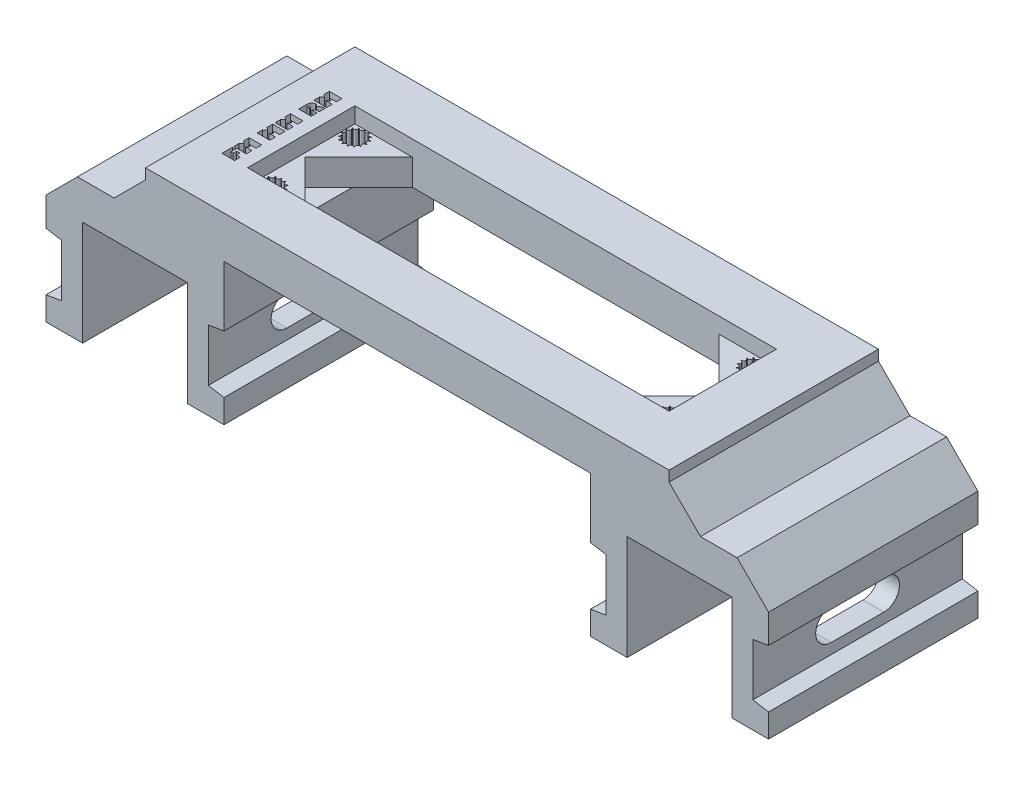
from build123d import *

# Parameters (mm, degrees)
SKETCH1_W                                = 80
SKETCH1_H                                = 20
BOSS_EXTRUDE1_DEPTH                      = 8
CUT_EXTRUDE1_DEPTH                       = 8
SKETCH3_W                                = 100
SKETCH3_H                                = 40
SKETCH3_W_2                              = 80
SKETCH3_H_2                              = 20
BOSS_EXTRUDE2_DEPTH                      = 8
CUT_EXTRUDE2_DEPTH                       = 12
MIRROR1_AT_THE_SECOND_PLANE_COPY_1_DEPTH = 12
BOSS_EXTRUDE3_START                      = -0.0001
SKETCH4_W                                = 34
SKETCH4_H                                = 40
BOSS_EXTRUDE3_DEPTH                      = 27.0001
SKETCH5_W                                = 20
SKETCH5_H                                = 20.0001
CUT_EXTRUDE3_DEPTH                       = 51
CUT_EXTRUDE4_DEPTH                       = 51
MIRROR3_COPY_1_DEPTH                     = 51
FILLET1_SIZE                             = 6
CUT_EXTRUDE5_DEPTH                       = 160
SKETCH8_W                                = 80.5
SKETCH8_H                                = 20.5
CUT_EXTRUDE6_DEPTH                       = 3
CUT_EXTRUDE8_START                       = -5
CUT_EXTRUDE8_DEPTH                       = 5
BOSS_EXTRUDE4_DEPTH                      = 5
MIRROR7_COPY_1_DEPTH                     = 5
CUT_EXTRUDE9_DEPTH                       = 2


with BuildPart() as part:
    # Sketch1 → Boss-Extrude1 (new body)
    with BuildSketch(Plane(origin=(0, 0, 0), x_dir=(1, 0, 0), z_dir=(0, 1, 0))):
        with Locations((40, 10)):
            Rectangle(SKETCH1_W, SKETCH1_H)
    extrude(amount=BOSS_EXTRUDE1_DEPTH)

    # Sketch2 → Cut-Extrude1 (cut)
    with BuildSketch(Plane(origin=(0, 8, 0), x_dir=(1, 0, 0), z_dir=(0, 1, 0))):
        with BuildLine():
            ThreePointArc((0, 5.464101615), (4.828427125, 4.828427125), (5.464101615, 0))
            Line((5.464101615, 0), (74.535898385, 0))
            ThreePointArc((74.535898385, 0), (75.171572875, 4.828427125), (80, 5.464101615))
            Line((80, 5.464101615), (80, 14.535898385))
            ThreePointArc((80, 14.535898385), (75.171572875, 15.171572875), (74.535898385, 20))
            Line((74.535898385, 20), (5.464101615, 20))
            ThreePointArc((5.464101615, 20), (4.828427125, 15.171572875), (0, 14.535898385))
            Line((0, 14.535898385), (0, 5.464101615))
        make_face()
    extrude(amount=-CUT_EXTRUDE1_DEPTH, mode=Mode.SUBTRACT)


with BuildPart() as cut_extrude1_piece_1:
    # of the separate pieces the step leaves, piece 1, a body of its own (cut_extrude1_pieces)
    add(part.part.solids().sort_by_distance((74.535898385, 0, 0))[0])



with BuildPart() as cut_extrude1_piece_2:
    # of the separate pieces the step leaves, piece 2, a body of its own (cut_extrude1_pieces)
    add(part.part.solids().sort_by_distance((80, 0, -14.535898385))[0])


with BuildPart() as cut_extrude1_piece_3:
    # of the separate pieces the step leaves, piece 3, a body of its own (cut_extrude1_pieces)
    add(part.part.solids().sort_by_distance((0, 0, 0))[0])


with BuildPart() as cut_extrude1_piece_4:
    # of the separate pieces the step leaves, piece 4, a body of its own (cut_extrude1_pieces)
    add(part.part.solids().sort_by_distance((0, 0, -20))[0])


with BuildPart() as cut_extrude1_piece_1_1:
    add(cut_extrude1_piece_1.part)

    add(cut_extrude1_piece_2.part)  # Boss-Extrude2 merges Cut-Extrude1 piece 2

    add(cut_extrude1_piece_3.part)  # Boss-Extrude2 merges Cut-Extrude1 piece 3

    add(cut_extrude1_piece_4.part)  # Boss-Extrude2 merges Cut-Extrude1 piece 4
    # Sketch3 → Boss-Extrude2 (add)
    with BuildSketch(Plane(origin=(0, 8, 0), x_dir=(1, 0, 0), z_dir=(0, 1, 0))):
        with Locations((40, 10)):
            Rectangle(SKETCH3_W, SKETCH3_H)
        with Locations((40, 10)):
            Rectangle(SKETCH3_W_2, SKETCH3_H_2, mode=Mode.SUBTRACT)
    extrude(amount=-BOSS_EXTRUDE2_DEPTH)

    # Sketch2<3> → Cut-Extrude2 (cut)
    with BuildSketch(Plane(origin=(0, 8, 0), x_dir=(1, 0, 0), z_dir=(0, 1, 0))):
        with BuildLine():
            Line((2.55692021, 0), (2.72832175, 0))
            ThreePointArc((2.72832175, 0), (2.980061227, 0.424260159), (3.452261136, 0.281443165))
            ThreePointArc((3.452261136, 0.281443165), (3.505543864, 0.327924143), (3.557339776, 0.376056398))
            ThreePointArc((3.557339776, 0.376056398), (3.49668144, 0.912597283), (4.025706602, 1.020708029))
            ThreePointArc((4.025706602, 1.020708029), (4.05547728, 1.084842553), (4.083218047, 1.149880851))
            ThreePointArc((4.083218047, 1.149880851), (3.809573061, 1.615363372), (4.248888993, 1.929301372))
            ThreePointArc((4.248888993, 1.929301372), (4.249722231, 1.964646321), (4.25, 2))
            ThreePointArc((4.25, 2), (4.249722231, 2.035353679), (4.248888993, 2.070698628))
            ThreePointArc((4.248888993, 2.070698628), (3.809573061, 2.384636628), (4.083218047, 2.850119149))
            ThreePointArc((4.083218047, 2.850119149), (4.05547728, 2.915157447), (4.025706602, 2.979291971))
            ThreePointArc((4.025706602, 2.979291971), (3.49668144, 3.087402717), (3.557339776, 3.623943602))
            ThreePointArc((3.557339776, 3.623943602), (3.505543864, 3.672075857), (3.452261136, 3.718556835))
            ThreePointArc((3.452261136, 3.718556835), (2.925, 3.602146997), (2.762183309, 4.116973454))
            ThreePointArc((2.762183309, 4.116973454), (2.695288237, 4.139877162), (2.627706526, 4.160667609))
            ThreePointArc((2.627706526, 4.160667609), (2.193377657, 3.839865506), (1.835238423, 4.243959363))
            ThreePointArc((1.835238423, 4.243959363), (1.764810958, 4.237674265), (1.694615755, 4.229179325))
            ThreePointArc((1.694615755, 4.229179325), (1.702179747, 4.184812687), (1.704711763, 4.139877162))
            ThreePointArc((1.704711763, 4.139877162), (1.3847999, 3.747976804), (0.936782312, 3.982944313))
            ThreePointArc((0.936782312, 3.982944313), (0.875, 3.948557159), (0.814328695, 3.912245684))
            ThreePointArc((0.814328695, 3.912245684), (0.87389587, 3.798667674), (0.894456136, 3.672075857))
            ThreePointArc((0.894456136, 3.672075857), (0.654274821, 3.305390723), (0.222166197, 3.379060176))
            ThreePointArc((0.222166197, 3.379060176), (0.179711763, 3.322516818), (0.139054975, 3.264667392))
            ThreePointArc((0.139054975, 3.264667392), (0.289350867, 3.117872886), (0.34452272, 2.915157447))
            ThreePointArc((0.34452272, 2.915157447), (0.246342958, 2.652660696), (0, 2.519023289))
            Line((0, 2.519023289), (0, 2.3122499))
            ThreePointArc((0, 2.3122499), (0.110555128, 2.173205081), (0.15, 2))
            ThreePointArc((0.15, 2), (0.110555128, 1.826794919), (0, 1.6877501))
            Line((0, 1.6877501), (0, 1.480976711))
            ThreePointArc((0, 1.480976711), (0.246342958, 1.347339304), (0.34452272, 1.084842553))
            ThreePointArc((0.34452272, 1.084842553), (0.289350867, 0.882127114), (0.139054975, 0.735332608))
            ThreePointArc((0.139054975, 0.735332608), (0.179711763, 0.677483182), (0.222166197, 0.620939824))
            ThreePointArc((0.222166197, 0.620939824), (0.654274821, 0.694609277), (0.894456136, 0.327924143))
            ThreePointArc((0.894456136, 0.327924143), (0.87389587, 0.201332326), (0.814328695, 0.087754316))
            ThreePointArc((0.814328695, 0.087754316), (0.875, 0.051442841), (0.936782312, 0.017055687))
            ThreePointArc((0.936782312, 0.017055687), (1.313895423, 0.2600174), (1.679457516, 0))
            Line((1.679457516, 0), (1.913457875, 0))
            ThreePointArc((1.913457875, 0), (2.235189042, 0.162325735), (2.55692021, 0))
        make_face()
        with BuildLine():
            ThreePointArc((0, 1.6877501), (-0.100863587, 1.628841907), (-0.214444444, 1.601583381))
            ThreePointArc((-0.214444444, 1.601583381), (-0.200832102, 1.532198696), (-0.185046302, 1.463275993))
            ThreePointArc((-0.185046302, 1.463275993), (-0.093565669, 1.483025017), (0, 1.480976711))
            Line((0, 1.480976711), (0, 1.6877501))
        make_face()
        with BuildLine():
            ThreePointArc((0, 2.519023289), (-0.093565669, 2.516974983), (-0.185046302, 2.536724007))
            ThreePointArc((-0.185046302, 2.536724007), (-0.200832102, 2.467801304), (-0.214444444, 2.398416619))
            ThreePointArc((-0.214444444, 2.398416619), (-0.100863587, 2.371158093), (0, 2.3122499))
            Line((0, 2.3122499), (0, 2.519023289))
        make_face()
        with BuildLine():
            ThreePointArc((1.694615755, -0.229179325), (1.764810958, -0.237674265), (1.835238423, -0.243959363))
            ThreePointArc((1.835238423, -0.243959363), (1.85428854, -0.115548071), (1.913457875, 0))
            Line((1.913457875, 0), (1.679457516, 0))
            ThreePointArc((1.679457516, 0), (1.698347572, -0.068807834), (1.704711763, -0.139877162))
            ThreePointArc((1.704711763, -0.139877162), (1.702179747, -0.184812687), (1.694615755, -0.229179325))
        make_face()
        with BuildLine():
            ThreePointArc((2.627706526, -0.160667609), (2.695288237, -0.139877162), (2.762183309, -0.116973454))
            ThreePointArc((2.762183309, -0.116973454), (2.740775016, -0.059782881), (2.72832175, 0))
            Line((2.72832175, 0), (2.55692021, 0))
            ThreePointArc((2.55692021, 0), (2.601237269, -0.076402147), (2.627706526, -0.160667609))
        make_face()
    cut_extrude2 = extrude(amount=-CUT_EXTRUDE2_DEPTH, mode=Mode.SUBTRACT)

    # Mirror1: Cut-Extrude2 across plane
    add(cut_extrude2.mirror(Plane.XY.offset(-10)), mode=Mode.SUBTRACT)

    # Mirror1 at the second plane: Cut-Extrude2 across plane
    add(cut_extrude2.mirror(Plane.ZY.offset(-40)), mode=Mode.SUBTRACT)

    # Mirror1 at the second plane copy 1 sketc → Mirror1 at the second plane copy 1 (cut)
    with BuildSketch(Plane(origin=(80, 8, -20), x_dir=(-1, 0, 0), z_dir=(0, 1, 0))):
        with BuildLine():
            Line((2.55692021, 0), (2.72832175, 0))
            ThreePointArc((2.72832175, 0), (2.980061227, 0.424260159), (3.452261136, 0.281443165))
            ThreePointArc((3.452261136, 0.281443165), (3.505543864, 0.327924143), (3.557339776, 0.376056398))
            ThreePointArc((3.557339776, 0.376056398), (3.49668144, 0.912597283), (4.025706602, 1.020708029))
            ThreePointArc((4.025706602, 1.020708029), (4.05547728, 1.084842553), (4.083218047, 1.149880851))
            ThreePointArc((4.083218047, 1.149880851), (3.809573061, 1.615363372), (4.248888993, 1.929301372))
            ThreePointArc((4.248888993, 1.929301372), (4.249722231, 1.964646321), (4.25, 2))
            ThreePointArc((4.25, 2), (4.249722231, 2.035353679), (4.248888993, 2.070698628))
            ThreePointArc((4.248888993, 2.070698628), (3.809573061, 2.384636628), (4.083218047, 2.850119149))
            ThreePointArc((4.083218047, 2.850119149), (4.05547728, 2.915157447), (4.025706602, 2.979291971))
            ThreePointArc((4.025706602, 2.979291971), (3.49668144, 3.087402717), (3.557339776, 3.623943602))
            ThreePointArc((3.557339776, 3.623943602), (3.505543864, 3.672075857), (3.452261136, 3.718556835))
            ThreePointArc((3.452261136, 3.718556835), (2.925, 3.602146997), (2.762183309, 4.116973454))
            ThreePointArc((2.762183309, 4.116973454), (2.695288237, 4.139877162), (2.627706526, 4.160667609))
            ThreePointArc((2.627706526, 4.160667609), (2.193377657, 3.839865506), (1.835238423, 4.243959363))
            ThreePointArc((1.835238423, 4.243959363), (1.764810958, 4.237674265), (1.694615755, 4.229179325))
            ThreePointArc((1.694615755, 4.229179325), (1.702179747, 4.184812687), (1.704711763, 4.139877162))
            ThreePointArc((1.704711763, 4.139877162), (1.3847999, 3.747976804), (0.936782312, 3.982944313))
            ThreePointArc((0.936782312, 3.982944313), (0.875, 3.948557159), (0.814328695, 3.912245684))
            ThreePointArc((0.814328695, 3.912245684), (0.87389587, 3.798667674), (0.894456136, 3.672075857))
            ThreePointArc((0.894456136, 3.672075857), (0.654274821, 3.305390723), (0.222166197, 3.379060176))
            ThreePointArc((0.222166197, 3.379060176), (0.179711763, 3.322516818), (0.139054975, 3.264667392))
            ThreePointArc((0.139054975, 3.264667392), (0.289350867, 3.117872886), (0.34452272, 2.915157447))
            ThreePointArc((0.34452272, 2.915157447), (0.246342958, 2.652660696), (0, 2.519023289))
            Line((0, 2.519023289), (0, 2.3122499))
            ThreePointArc((0, 2.3122499), (0.110555128, 2.173205081), (0.15, 2))
            ThreePointArc((0.15, 2), (0.110555128, 1.826794919), (0, 1.6877501))
            Line((0, 1.6877501), (0, 1.480976711))
            ThreePointArc((0, 1.480976711), (0.246342958, 1.347339304), (0.34452272, 1.084842553))
            ThreePointArc((0.34452272, 1.084842553), (0.289350867, 0.882127114), (0.139054975, 0.735332608))
            ThreePointArc((0.139054975, 0.735332608), (0.179711763, 0.677483182), (0.222166197, 0.620939824))
            ThreePointArc((0.222166197, 0.620939824), (0.654274821, 0.694609277), (0.894456136, 0.327924143))
            ThreePointArc((0.894456136, 0.327924143), (0.87389587, 0.201332326), (0.814328695, 0.087754316))
            ThreePointArc((0.814328695, 0.087754316), (0.875, 0.051442841), (0.936782312, 0.017055687))
            ThreePointArc((0.936782312, 0.017055687), (1.313895423, 0.2600174), (1.679457516, 0))
            Line((1.679457516, 0), (1.913457875, 0))
            ThreePointArc((1.913457875, 0), (2.235189042, 0.162325735), (2.55692021, 0))
        make_face()
        with BuildLine():
            ThreePointArc((0, 1.6877501), (-0.100863587, 1.628841907), (-0.214444444, 1.601583381))
            ThreePointArc((-0.214444444, 1.601583381), (-0.200832102, 1.532198696), (-0.185046302, 1.463275993))
            ThreePointArc((-0.185046302, 1.463275993), (-0.093565669, 1.483025017), (0, 1.480976711))
            Line((0, 1.480976711), (0, 1.6877501))
        make_face()
        with BuildLine():
            ThreePointArc((0, 2.519023289), (-0.093565669, 2.516974983), (-0.185046302, 2.536724007))
            ThreePointArc((-0.185046302, 2.536724007), (-0.200832102, 2.467801304), (-0.214444444, 2.398416619))
            ThreePointArc((-0.214444444, 2.398416619), (-0.100863587, 2.371158093), (0, 2.3122499))
            Line((0, 2.3122499), (0, 2.519023289))
        make_face()
        with BuildLine():
            ThreePointArc((1.694615755, -0.229179325), (1.764810958, -0.237674265), (1.835238423, -0.243959363))
            ThreePointArc((1.835238423, -0.243959363), (1.85428854, -0.115548071), (1.913457875, 0))
            Line((1.913457875, 0), (1.679457516, 0))
            ThreePointArc((1.679457516, 0), (1.698347572, -0.068807834), (1.704711763, -0.139877162))
            ThreePointArc((1.704711763, -0.139877162), (1.702179747, -0.184812687), (1.694615755, -0.229179325))
        make_face()
        with BuildLine():
            ThreePointArc((2.627706526, -0.160667609), (2.695288237, -0.139877162), (2.762183309, -0.116973454))
            ThreePointArc((2.762183309, -0.116973454), (2.740775016, -0.059782881), (2.72832175, 0))
            Line((2.72832175, 0), (2.55692021, 0))
            ThreePointArc((2.55692021, 0), (2.601237269, -0.076402147), (2.627706526, -0.160667609))
        make_face()
    extrude(amount=-MIRROR1_AT_THE_SECOND_PLANE_COPY_1_DEPTH, mode=Mode.SUBTRACT)

    # Sketch4 → Boss-Extrude3 (add)
    with BuildSketch(Plane.XZ.offset(BOSS_EXTRUDE3_START)):
        with Locations((-12, -10)):
            Rectangle(SKETCH4_W, SKETCH4_H)
    boss_extrude3 = extrude(amount=BOSS_EXTRUDE3_DEPTH)

    # Sketch5 → Cut-Extrude3 (cut)
    with BuildSketch(Plane(origin=(0, 0, -30), x_dir=(-1, 0, 0), z_dir=(0, 0, -1))):
        with Locations((12, -16.99995)):
            Rectangle(SKETCH5_W, SKETCH5_H)
    cut_extrude3 = extrude(amount=-CUT_EXTRUDE3_DEPTH, mode=Mode.SUBTRACT)

    # Sketch6 → Cut-Extrude4 (cut)
    with BuildSketch(Plane(origin=(0, 0, -30), x_dir=(-1, 0, 0), z_dir=(0, 0, -1))):
        Polygon((29, -11.4999), (29, -22.5), (26, -21.99995), (26, -11.99995), align=None)
    cut_extrude4 = extrude(amount=-CUT_EXTRUDE4_DEPTH, mode=Mode.SUBTRACT)

    # Mirror2: Cut-Extrude4 across plane
    add(cut_extrude4.mirror(Plane(origin=(-12, 0, 0), x_dir=(0, 0, 1), z_dir=(1, 0, 0))), mode=Mode.SUBTRACT)

    # Mirror3: Boss-Extrude3, Cut-Extrude3, Cut-Extrude4 across plane
    add(boss_extrude3.mirror(Plane.ZY.offset(-40)))
    add(cut_extrude3.mirror(Plane.ZY.offset(-40)), mode=Mode.SUBTRACT)
    add(cut_extrude4.mirror(Plane.ZY.offset(-40)), mode=Mode.SUBTRACT)

    # Mirror3 copy 1 sketch → Mirror3 copy 1 (cut)
    with BuildSketch(Plane(origin=(104, 0, -30), x_dir=(-1, 0, 0), z_dir=(0, 0, -1))):
        Polygon((29, -11.4999), (29, -22.5), (26, -21.99995), (26, -11.99995), align=None)
    extrude(amount=-MIRROR3_COPY_1_DEPTH, mode=Mode.SUBTRACT)

    # Fillet1
    fillet1_edges = [cut_extrude1_piece_1_1.edges().sort_by_distance(p)[0] for p in [
        (-10, 0.0001, -10),
        (-29, 0.0001, -10),
        (90, 0.0001, -10),
        (109, 0.0001, -10),
    ]]
    chamfer(fillet1_edges, length=FILLET1_SIZE)

    # Sketch7 → Cut-Extrude5 (cut)
    with BuildSketch(Plane.ZY.offset(26)):
        with BuildLine():
            Line((-5, -19.99995), (-15, -19.99995))
            ThreePointArc((-15, -19.99995), (-18, -16.99995), (-15, -13.99995))
            Line((-15, -13.99995), (-5, -13.99995))
            ThreePointArc((-5, -13.99995), (-2, -16.99995), (-5, -19.99995))
        make_face()
    extrude(amount=-CUT_EXTRUDE5_DEPTH, mode=Mode.SUBTRACT)

    # Sketch8 → Cut-Extrude6 (cut)
    with BuildSketch(Plane(origin=(0, 8, 0), x_dir=(1, 0, 0), z_dir=(0, 1, 0))):
        with Locations((40, 10)):
            Rectangle(SKETCH8_W, SKETCH8_H)
    extrude(amount=-CUT_EXTRUDE6_DEPTH, mode=Mode.SUBTRACT)

    # Sketch10 → Cut-Extrude8 (cut)
    with BuildSketch(Plane(origin=(0, 5, 0), x_dir=(1, 0, 0), z_dir=(0, 1, 0)).offset(CUT_EXTRUDE8_START)):
        with BuildLine():
            ThreePointArc((80, 5.464101615), (80.126447832, 5.387952128), (80.25, 5.307189139))
            Line((80.25, 5.307189139), (80.25, 14.692810861))
            ThreePointArc((80.25, 14.692810861), (80.126447832, 14.612047872), (80, 14.535898385))
            Line((80, 14.535898385), (80, 5.464101615))
        make_face()
        with BuildLine():
            Line((5.307189139, -0.25), (74.692810861, -0.25))
            ThreePointArc((74.692810861, -0.25), (74.612047872, -0.126447832), (74.535898385, 0))
            Line((74.535898385, 0), (5.464101615, 0))
            ThreePointArc((5.464101615, 0), (5.387952128, -0.126447832), (5.307189139, -0.25))
        make_face()
        with BuildLine():
            Line((-0.25, 14.692810861), (-0.25, 5.307189139))
            ThreePointArc((-0.25, 5.307189139), (-0.126447832, 5.387952128), (0, 5.464101615))
            Line((0, 5.464101615), (0, 14.535898385))
            ThreePointArc((0, 14.535898385), (-0.126447832, 14.612047872), (-0.25, 14.692810861))
        make_face()
        with BuildLine():
            ThreePointArc((74.535898385, 20), (74.612047872, 20.126447832), (74.692810861, 20.25))
            Line((74.692810861, 20.25), (5.307189139, 20.25))
            ThreePointArc((5.307189139, 20.25), (5.387952128, 20.126447832), (5.464101615, 20))
            Line((5.464101615, 20), (74.535898385, 20))
        make_face()
    extrude(amount=CUT_EXTRUDE8_DEPTH, mode=Mode.SUBTRACT)

    # Sketch11 → Boss-Extrude4 (add)
    with BuildSketch(Plane(origin=(0, 5, 0), x_dir=(1, 0, 0), z_dir=(0, 1, 0))):
        with BuildLine():
            Line((80.25, 5.307189139), (80.25, 10.75))
            Line((80.25, 10.75), (69.25, -0.25))
            Line((69.25, -0.25), (74.692810861, -0.25))
            ThreePointArc((74.692810861, -0.25), (75.171572875, 4.828427125), (80.25, 5.307189139))
        make_face()
    boss_extrude4 = extrude(amount=-BOSS_EXTRUDE4_DEPTH)

    # Mirror6: Boss-Extrude4 across plane
    add(boss_extrude4.mirror(Plane.ZY.offset(-40)))

    # Mirror7: Boss-Extrude4 across plane
    add(boss_extrude4.mirror(Plane.XY.offset(-10)))

    # Mirror7 copy 1 sketch → Mirror7 copy 1 (add)
    with BuildSketch(Plane(origin=(80, 5, -20), x_dir=(-1, 0, 0), z_dir=(0, 1, 0))):
        with BuildLine():
            Line((80.25, 5.307189139), (80.25, 10.75))
            Line((80.25, 10.75), (69.25, -0.25))
            Line((69.25, -0.25), (74.692810861, -0.25))
            ThreePointArc((74.692810861, -0.25), (75.171572875, 4.828427125), (80.25, 5.307189139))
        make_face()
    extrude(amount=-MIRROR7_COPY_1_DEPTH)

    # Sketch12 → Cut-Extrude9 (cut)
    # profile 1 of 6: a face of its own
    with BuildSketch(Plane(origin=(0, 8, 0), x_dir=(1, 0, 0), z_dir=(0, 1, 0))):
        Polygon((-2.684122609, -0.291316755), (-5.084122609, -0.291316755), (-5.084122609, 1.688683245), (-4.484122609, 1.688683245), (-4.484122609, 0.788683245), (-4.034122609, 0.788683245), (-4.034122609, 1.448683245), (-3.434122609, 1.448683245), (-3.434122609, 0.788683245), (-2.684122609, 0.788683245), align=None)
    # profile 2 of 6: a face of its own
    with BuildSketch(Plane(origin=(0, 8, 0), x_dir=(1, 0, 0), z_dir=(0, 1, 0))):
        Polygon((-2.684122609, 1.928683245), (-5.084122609, 1.928683245), (-5.084122609, 2.976808245), (-4.581153859, 3.398683245), (-5.084122609, 3.821964495), (-5.084122609, 4.868683245), (-2.684122609, 4.868683245), (-2.684122609, 3.788683245), (-3.878028859, 3.788683245), (-3.411153859, 3.398683245), (-3.878028859, 3.008683245), (-2.684122609, 3.008683245), align=None)
    # profile 3 of 6: a face of its own
    with BuildSketch(Plane(origin=(0, 8, 0), x_dir=(1, 0, 0), z_dir=(0, 1, 0))):
        Polygon((-2.684122609, 6.428683245), (-5.084122609, 6.428683245), (-5.084122609, 7.476808245), (-4.581153859, 7.898683245), (-5.084122609, 8.321964495), (-5.084122609, 9.368683245), (-2.684122609, 9.368683245), (-2.684122609, 8.288683245), (-3.878028859, 8.288683245), (-3.411153859, 7.898683245), (-3.878028859, 7.508683245), (-2.684122609, 7.508683245), align=None)
    # profile 4 of 6: a face of its own
    with BuildSketch(Plane(origin=(0, 8, 0), x_dir=(1, 0, 0), z_dir=(0, 1, 0))):
        Polygon((-2.684122609, 9.848683245), (-5.084122609, 9.848683245), (-5.084122609, 10.896808245), (-4.581153859, 11.318683245), (-5.084122609, 11.741964495), (-5.084122609, 12.788683245), (-2.684122609, 12.788683245), (-2.684122609, 11.708683245), (-3.878028859, 11.708683245), (-3.411153859, 11.318683245), (-3.878028859, 10.928683245), (-2.684122609, 10.928683245), align=None)
    # profile 5 of 6: a face of its own
    with BuildSketch(Plane(origin=(0, 8, 0), x_dir=(1, 0, 0), z_dir=(0, 1, 0))):
        with BuildLine():
            Line((-5.084122609, 14.348683245), (-5.084122609, 15.928839495))
            add(Edge.make_bspline(
                [(-5.084122609, 15.928839495), (-5.083493806, 15.962145212), (-5.082266082, 16.027173945), (-5.072703114, 16.121777711), (-5.057699588, 16.211137274), (-5.034864788, 16.294547589), (-5.00696223, 16.373059104), (-4.972278502, 16.445806257), (-4.931172643, 16.513092127), (-4.883970309, 16.57420659), (-4.831934078, 16.628942215), (-4.776604983, 16.677204992), (-4.717597273, 16.717582846), (-4.655892704, 16.751345449), (-4.590714222, 16.777252009), (-4.522288804, 16.795539232), (-4.450724994, 16.80647686), (-4.401973053, 16.807940787), (-4.377247609, 16.808683245)],
                knots=[0, 0, 0, 0, 1.262361611, 2.464735302, 3.601191455, 4.693216455, 5.738756384, 6.756147977, 7.742582361, 8.722396484, 9.677696867, 10.601592638, 11.500328079, 12.382931945, 13.262888241, 14.1523034, 15.062906665, 16, 16, 16, 16], degree=3))
            add(Edge.make_bspline(
                [(-4.377247609, 16.808683245), (-4.350159604, 16.807950075), (-4.297056404, 16.806512772), (-4.21978548, 16.792962372), (-4.14689042, 16.771376612), (-4.078538384, 16.741370379), (-4.014884755, 16.702357662), (-3.956168148, 16.654597826), (-3.901507111, 16.598376978), (-3.87017964, 16.555502495), (-3.854122609, 16.533526995)],
                knots=[0, 0, 0, 0, 1.052991086, 2.064278821, 3.041225167, 4.004632968, 4.959547, 5.936379882, 6.94228264, 8, 8, 8, 8], degree=3))
            add(Edge.make_bspline(
                [(-3.854122609, 16.533526995), (-3.815564992, 16.56436979), (-3.738166877, 16.62628166), (-3.612123337, 16.707209134), (-3.478021811, 16.778895456), (-3.335212612, 16.839873404), (-3.184429854, 16.892240902), (-3.025251286, 16.93467986), (-2.857665012, 16.967705671), (-2.742669832, 16.981606135), (-2.684122609, 16.988683245)],
                knots=[0, 0, 0, 0, 0.92931193, 1.865441822, 2.815849114, 3.789867019, 4.786484956, 5.819284688, 6.889737603, 8, 8, 8, 8], degree=3))
            Line((-2.684122609, 16.988683245), (-2.684122609, 15.878683245))
            add(Edge.make_bspline(
                [(-2.684122609, 15.878683245), (-2.722414708, 15.87602378), (-2.796566334, 15.870873797), (-2.904027634, 15.860898997), (-3.003545019, 15.847589971), (-3.095609093, 15.832970847), (-3.179515006, 15.815072791), (-3.256083661, 15.79579988), (-3.324490768, 15.773077882), (-3.38581703, 15.749227247), (-3.439643974, 15.721785788), (-3.486469575, 15.691115028), (-3.525770019, 15.656051894), (-3.558334252, 15.617739407), (-3.583355518, 15.575535024), (-3.601569311, 15.529900879), (-3.611865132, 15.480387788), (-3.613356508, 15.446229789), (-3.614122609, 15.428683245)],
                knots=[0, 0, 0, 0, 1.623156331, 3.143198878, 4.562665808, 5.868326318, 7.08385764, 8.189631603, 9.205097301, 10.130216423, 10.969450051, 11.755610022, 12.490330884, 13.189115451, 13.87353936, 14.555727105, 15.258094807, 16, 16, 16, 16], degree=3))
            Line((-3.614122609, 15.428683245), (-2.684122609, 15.428683245))
            Line((-2.684122609, 15.428683245), (-2.684122609, 14.348683245))
            Line((-2.684122609, 14.348683245), (-5.084122609, 14.348683245))
        make_face()
        with BuildLine():
            Line((-4.574122609, 15.428683245), (-4.124122609, 15.428683245))
            Line((-4.124122609, 15.428683245), (-4.124122609, 15.456808245))
            add(Edge.make_bspline(
                [(-4.124122609, 15.456808245), (-4.124639744, 15.478100334), (-4.125612698, 15.518159934), (-4.13563613, 15.57411283), (-4.153059594, 15.621618735), (-4.17687841, 15.661135797), (-4.208651249, 15.692004211), (-4.247523137, 15.713815804), (-4.293341442, 15.726593522), (-4.325912994, 15.727963396), (-4.343028859, 15.728683245)],
                knots=[0, 0, 0, 0, 1.281284342, 2.410648368, 3.405042806, 4.313608888, 5.165296009, 6.04172533, 6.970955872, 8, 8, 8, 8], degree=3))
            add(Edge.make_bspline(
                [(-4.343028859, 15.728683245), (-4.357937435, 15.728123139), (-4.387194481, 15.727023969), (-4.42970036, 15.716192415), (-4.469406252, 15.698772565), (-4.505940867, 15.67442967), (-4.53754473, 15.641802468), (-4.559036215, 15.598691818), (-4.572341237, 15.547286711), (-4.573501643, 15.510027798), (-4.574122609, 15.490089495)],
                knots=[0, 0, 0, 0, 0.948247289, 1.8608696, 2.774577073, 3.699494778, 4.643132796, 5.631596393, 6.732599921, 8, 8, 8, 8], degree=3))
            Line((-4.574122609, 15.490089495), (-4.574122609, 15.428683245))
        make_face(mode=Mode.SUBTRACT)
    # profile 6 of 6: a face of its own
    with BuildSketch(Plane(origin=(0, 8, 0), x_dir=(1, 0, 0), z_dir=(0, 1, 0))):
        Polygon((-2.684122609, 17.258683245), (-5.084122609, 17.258683245), (-5.084122609, 18.306808245), (-4.581153859, 18.728683245), (-5.084122609, 19.151964495), (-5.084122609, 20.198683245), (-2.684122609, 20.198683245), (-2.684122609, 19.118683245), (-3.878028859, 19.118683245), (-3.411153859, 18.728683245), (-3.878028859, 18.338683245), (-2.684122609, 18.338683245), align=None)
    extrude(amount=-CUT_EXTRUDE9_DEPTH, mode=Mode.SUBTRACT)


solid = cut_extrude1_piece_1_1.part
